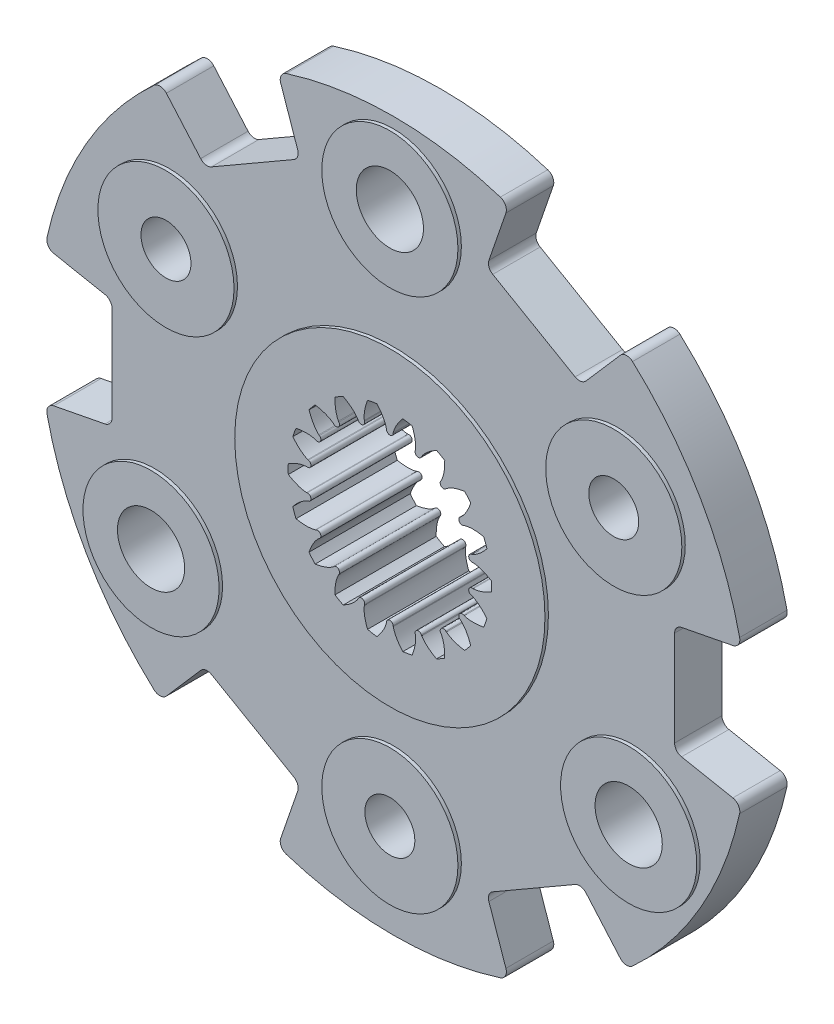
from build123d import *

# Parameters (mm, degrees)
SKETCH1_R                            = 10.4521
BASE_DEPTH                           = 1.397
SKETCH2_R                            = 2.0066
PLATFORMS_DEPTH                      = 0.1016
SKETCH3_R                            = 0.9906
SKETCH3_R_2                          = 0.7366
HOLES_DEPTH                          = 15.857274002
PATTERN_OF_PLATFORMS_AND_HOLES_COUNT = 3
NOTCH_DEPTH                          = 15.847370064
PATTERN_OF_NOTCH_COUNT               = 6
EDGE_FILLET_R                        = 0.254
HUB_DEPTH                            = 1.4859
HUB_DEPTH_BACK                       = 1.4986
SKETCH5_R                            = 4.572
HUB_CHAMFER_SIZE                     = 0.381
INTERNAL_START                       = -1.4859
INTERNAL_CAVITY_DEPTH                = 2.9845
OFFSET_CAVITY_CUT_DEPTH              = 15.915170021


# Read off the part's stored shape, not the designer's step: Internal cavity
with BuildPart() as part:
    # Sketch1 → Base (new body)
    with BuildSketch(Plane.XY):
        Circle(SKETCH1_R)
    extrude(amount=BASE_DEPTH)

    # Sketch2 → Platforms (add)
    with BuildSketch(Plane.XY.offset(1.397)):
        with Locations((0, 8.128)):
            Circle(SKETCH2_R)
        with Locations((0, -7.62)):
            Circle(SKETCH2_R)
    platforms = extrude(amount=PLATFORMS_DEPTH)

    # Sketch3 → Holes (cut, through all)
    with BuildSketch(Plane.XY.offset(1.4986)):
        with Locations((0, 8.128)):
            Circle(SKETCH3_R)
        with Locations((0, -7.62)):
            Circle(SKETCH3_R_2)
    holes = extrude(amount=-HOLES_DEPTH, mode=Mode.SUBTRACT)

    # Pattern of platforms and holes: Platforms, Holes ×3 about axis
    pattern_of_platforms_and_holes_axis = Axis((0, 0, 0), (0, 0, 1))
    add([platforms.rotate(pattern_of_platforms_and_holes_axis, i * 360 / PATTERN_OF_PLATFORMS_AND_HOLES_COUNT) for i in range(1, PATTERN_OF_PLATFORMS_AND_HOLES_COUNT)])
    add([holes.rotate(pattern_of_platforms_and_holes_axis, i * 360 / PATTERN_OF_PLATFORMS_AND_HOLES_COUNT) for i in range(1, PATTERN_OF_PLATFORMS_AND_HOLES_COUNT)], mode=Mode.SUBTRACT)

    # Sketch4 → Notch (cut, through all)
    with BuildSketch(Plane.XY.offset(1.397)):
        with BuildLine():
            Line((-5.540746529, 6.37389976), (-6.857194577, 7.888300003))
            ThreePointArc((-6.857194577, 7.888300003), (-5.22605, 9.051784123), (-3.402870907, 9.882654704))
            Line((-3.402870907, 9.882654704), (-2.749585848, 7.98537713))
            Line((-2.749585848, 7.98537713), (-5.540746529, 6.37389976))
        make_face()
    notch = extrude(amount=-NOTCH_DEPTH, mode=Mode.SUBTRACT)

    # Pattern of notch: Notch ×6 about axis
    pattern_of_notch_axis = Axis((0, 0, 0), (0, 0, 1))
    for i in range(1, PATTERN_OF_NOTCH_COUNT):
        add(notch.rotate(pattern_of_notch_axis, i * 360 / PATTERN_OF_NOTCH_COUNT), mode=Mode.SUBTRACT)

    # Edge fillet
    edge_fillet_edges = [part.edges().sort_by_distance(p)[0] for p in [
        (6.857194577, -7.888300003, 0.6985),
        (3.402870907, -9.882654704, 0.6985),
        (2.749585848, -7.98537713, 0.6985),
        (5.540746529, -6.37389976, 0.6985),
        (10.260065484, 1.994354701, 0.6985),
        (10.260065484, -1.994354701, 0.6985),
        (8.290332378, -1.61147737, 0.6985),
        (8.290332378, 1.61147737, 0.6985),
        (3.402870907, 9.882654704, 0.6985),
        (6.857194577, 7.888300003, 0.6985),
        (5.540746529, 6.37389976, 0.6985),
        (2.749585848, 7.98537713, 0.6985),
        (-6.857194577, 7.888300003, 0.6985),
        (-3.402870907, 9.882654704, 0.6985),
        (-2.749585848, 7.98537713, 0.6985),
        (-5.540746529, 6.37389976, 0.6985),
        (-10.260065484, -1.994354701, 0.6985),
        (-10.260065484, 1.994354701, 0.6985),
        (-8.290332378, 1.61147737, 0.6985),
        (-8.290332378, -1.61147737, 0.6985),
        (-3.402870907, -9.882654704, 0.6985),
        (-6.857194577, -7.888300003, 0.6985),
        (-5.540746529, -6.37389976, 0.6985),
        (-2.749585848, -7.98537713, 0.6985),
    ]]
    fillet(edge_fillet_edges, radius=EDGE_FILLET_R)

    # Sketch5 → Hub (add, two sides: drawn at the far end of the back side and taken through both)
    with BuildSketch(Plane(origin=(0, 0, 0), x_dir=(-1, 0, 0), z_dir=(0, 0, -1)).offset(-HUB_DEPTH_BACK)):
        Circle(SKETCH5_R)
    extrude(amount=HUB_DEPTH + HUB_DEPTH_BACK)

    # Hub chamfer
    hub_chamfer_edges = [part.edges().sort_by_distance(p)[0] for p in [
        (4.572, 0, -1.4859),
    ]]
    chamfer(hub_chamfer_edges, length=HUB_CHAMFER_SIZE)

    # Internal cavity outline → Internal cavity (cut)
    with BuildSketch(Plane.XY.offset(INTERNAL_START)):
        with BuildLine():
            Line((-2.441544292, 0.253382626), (-2.457161288, 0.255003353))
            add(Edge.make_bspline(
                [(-2.457161288, 0.255003353), (-2.511970923, 0.25245669), (-2.674677864, 0.22493294), (-2.825486334, 0.152013752), (-2.91943351, 0.095650308)],
                knots=[0, 0, 0, 0, 0.332628043, 1, 1, 1, 1], degree=3))
            ThreePointArc((-2.91943351, 0.095650308), (-2.921, 0), (-2.91943351, -0.095650308))
            add(Edge.make_bspline(
                [(-2.457161288, -0.255003353), (-2.511970923, -0.25245669), (-2.674677864, -0.22493294), (-2.825486334, -0.152013752), (-2.91943351, -0.095650308)],
                knots=[0, 0, 0, 0, 0.332628043, 1, 1, 1, 1], degree=3))
            Line((-2.457161288, -0.255003353), (-2.441544292, -0.253382626))
            ThreePointArc((-2.441544292, -0.253382626), (-2.251270523, -0.396959734), (-2.380963117, -0.596955545))
            Line((-2.380963117, -0.596955545), (-2.396192614, -0.600773887))
            add(Edge.make_bspline(
                [(-2.396192614, -0.600773887), (-2.446825813, -0.621912967), (-2.590306648, -0.703425883), (-2.707080423, -0.82352704), (-2.776084458, -0.908623179)],
                knots=[0, 0, 0, 0, 0.332628043, 1, 1, 1, 1], degree=3))
            ThreePointArc((-2.776084458, -0.908623179), (-2.744842145, -0.999040839), (-2.710655794, -1.088386956))
            add(Edge.make_bspline(
                [(-2.221760047, -1.080023425), (-2.274135267, -1.096376344), (-2.436443455, -1.12616153), (-2.603096893, -1.109219442), (-2.710655794, -1.088386956)],
                knots=[0, 0, 0, 0, 0.332628043, 1, 1, 1, 1], degree=3))
            Line((-2.221760047, -1.080023425), (-2.207639193, -1.073159113))
            ThreePointArc((-2.207639193, -1.073159113), (-1.979734073, -1.143), (-2.03320265, -1.375292067))
            Line((-2.03320265, -1.375292067), (-2.046207746, -1.38408893))
            add(Edge.make_bspline(
                [(-2.046207746, -1.38408893), (-2.086557399, -1.421270741), (-2.193506221, -1.546941162), (-2.262160662, -1.699738317), (-2.29789865, -1.803303301)],
                knots=[0, 0, 0, 0, 0.332628043, 1, 1, 1, 1], degree=3))
            ThreePointArc((-2.29789865, -1.803303301), (-2.237615818, -1.877582608), (-2.174932985, -1.949848074))
            add(Edge.make_bspline(
                [(-1.718381755, -1.774776732), (-1.762005335, -1.80805683), (-1.904338008, -1.891558419), (-2.066735549, -1.932636897), (-2.174932985, -1.949848074)],
                knots=[0, 0, 0, 0, 0.332628043, 1, 1, 1, 1], degree=3))
            Line((-1.718381755, -1.774776732), (-1.707460225, -1.763496773))
            ThreePointArc((-1.707460225, -1.763496773), (-1.469412476, -1.751177597), (-1.440207937, -1.987748068))
            Line((-1.440207937, -1.987748068), (-1.449420026, -2.00046242))
            add(Edge.make_bspline(
                [(-1.449420026, -2.00046242), (-1.474619368, -2.049202288), (-1.532136572, -2.203872507), (-1.544390938, -2.370936067), (-1.542552351, -2.48047843)],
                knots=[0, 0, 0, 0, 0.332628043, 1, 1, 1, 1], degree=3))
            ThreePointArc((-1.542552351, -2.48047843), (-1.4605, -2.529660204), (-1.376881159, -2.576128738))
            add(Edge.make_bspline(
                [(-1.007741262, -2.255465773), (-1.037351555, -2.301658978), (-1.142541292, -2.428805447), (-1.281095396, -2.522949819), (-1.376881159, -2.576128738)],
                knots=[0, 0, 0, 0, 0.332628043, 1, 1, 1, 1], degree=3))
            Line((-1.007741262, -2.255465773), (-1.001336355, -2.241130695))
            ThreePointArc((-1.001336355, -2.241130695), (-0.781858048, -2.148137331), (-0.673502892, -2.360452317))
            Line((-0.673502892, -2.360452317), (-0.677810859, -2.375550619))
            add(Edge.make_bspline(
                [(-0.677810859, -2.375550619), (-0.684820479, -2.429969796), (-0.68596864, -2.594984302), (-0.640344874, -2.756163937), (-0.601151473, -2.858471253)],
                knots=[0, 0, 0, 0, 0.332628043, 1, 1, 1, 1], degree=3))
            ThreePointArc((-0.601151473, -2.858471253), (-0.507226327, -2.876623447), (-0.412757144, -2.891690257))
            add(Edge.make_bspline(
                [(-0.175552301, -2.464112355), (-0.187577868, -2.517647084), (-0.242937234, -2.673102692), (-0.340936231, -2.808957759), (-0.412757144, -2.891690257)],
                knots=[0, 0, 0, 0, 0.332628043, 1, 1, 1, 1], degree=3))
            Line((-0.175552301, -2.464112355), (-0.174436542, -2.44845118))
            ThreePointArc((-0.174436542, -2.44845118), (0, -2.286), (0.174436542, -2.44845118))
            Line((0.174436542, -2.44845118), (0.175552301, -2.464112355))
            add(Edge.make_bspline(
                [(0.175552301, -2.464112355), (0.187577868, -2.517647084), (0.242937234, -2.673102692), (0.340936231, -2.808957759), (0.412757144, -2.891690257)],
                knots=[0, 0, 0, 0, 0.332628043, 1, 1, 1, 1], degree=3))
            ThreePointArc((0.412757144, -2.891690257), (0.507226327, -2.876623447), (0.601151473, -2.858471253))
            add(Edge.make_bspline(
                [(0.677810859, -2.375550619), (0.684820479, -2.429969796), (0.68596864, -2.594984302), (0.640344874, -2.756163937), (0.601151473, -2.858471253)],
                knots=[0, 0, 0, 0, 0.332628043, 1, 1, 1, 1], degree=3))
            Line((0.677810859, -2.375550619), (0.673502892, -2.360452317))
            ThreePointArc((0.673502892, -2.360452317), (0.781858048, -2.148137331), (1.001336355, -2.241130695))
            Line((1.001336355, -2.241130695), (1.007741262, -2.255465773))
            add(Edge.make_bspline(
                [(1.007741262, -2.255465773), (1.037351555, -2.301658978), (1.142541292, -2.428805447), (1.281095396, -2.522949819), (1.376881159, -2.576128738)],
                knots=[0, 0, 0, 0, 0.332628043, 1, 1, 1, 1], degree=3))
            ThreePointArc((1.376881159, -2.576128738), (1.4605, -2.529660204), (1.542552351, -2.48047843))
            add(Edge.make_bspline(
                [(1.449420026, -2.00046242), (1.474619368, -2.049202288), (1.532136572, -2.203872507), (1.544390938, -2.370936067), (1.542552351, -2.48047843)],
                knots=[0, 0, 0, 0, 0.332628043, 1, 1, 1, 1], degree=3))
            Line((1.449420026, -2.00046242), (1.440207937, -1.987748068))
            ThreePointArc((1.440207937, -1.987748068), (1.469412476, -1.751177597), (1.707460225, -1.763496773))
            Line((1.707460225, -1.763496773), (1.718381755, -1.774776732))
            add(Edge.make_bspline(
                [(1.718381755, -1.774776732), (1.762005335, -1.80805683), (1.904338008, -1.891558419), (2.066735549, -1.932636897), (2.174932985, -1.949848074)],
                knots=[0, 0, 0, 0, 0.332628043, 1, 1, 1, 1], degree=3))
            ThreePointArc((2.174932985, -1.949848074), (2.237615818, -1.877582608), (2.29789865, -1.803303301))
            add(Edge.make_bspline(
                [(2.046207746, -1.38408893), (2.086557399, -1.421270741), (2.193506221, -1.546941162), (2.262160662, -1.699738317), (2.29789865, -1.803303301)],
                knots=[0, 0, 0, 0, 0.332628043, 1, 1, 1, 1], degree=3))
            Line((2.046207746, -1.38408893), (2.03320265, -1.375292067))
            ThreePointArc((2.03320265, -1.375292067), (1.979734073, -1.143), (2.207639193, -1.073159113))
            Line((2.207639193, -1.073159113), (2.221760047, -1.080023425))
            add(Edge.make_bspline(
                [(2.221760047, -1.080023425), (2.274135267, -1.096376344), (2.436443455, -1.12616153), (2.603096893, -1.109219442), (2.710655794, -1.088386956)],
                knots=[0, 0, 0, 0, 0.332628043, 1, 1, 1, 1], degree=3))
            ThreePointArc((2.710655794, -1.088386956), (2.744842145, -0.999040839), (2.776084458, -0.908623179))
            add(Edge.make_bspline(
                [(2.396192614, -0.600773887), (2.446825813, -0.621912967), (2.590306648, -0.703425883), (2.707080423, -0.82352704), (2.776084458, -0.908623179)],
                knots=[0, 0, 0, 0, 0.332628043, 1, 1, 1, 1], degree=3))
            Line((2.396192614, -0.600773887), (2.380963117, -0.596955545))
            ThreePointArc((2.380963117, -0.596955545), (2.251270523, -0.396959734), (2.441544292, -0.253382626))
            Line((2.441544292, -0.253382626), (2.457161288, -0.255003353))
            add(Edge.make_bspline(
                [(2.457161288, -0.255003353), (2.511970923, -0.25245669), (2.674677864, -0.22493294), (2.825486334, -0.152013752), (2.91943351, -0.095650308)],
                knots=[0, 0, 0, 0, 0.332628043, 1, 1, 1, 1], degree=3))
            ThreePointArc((2.91943351, -0.095650308), (2.921, 0), (2.91943351, 0.095650308))
            add(Edge.make_bspline(
                [(2.457161288, 0.255003353), (2.511970923, 0.25245669), (2.674677864, 0.22493294), (2.825486334, 0.152013752), (2.91943351, 0.095650308)],
                knots=[0, 0, 0, 0, 0.332628043, 1, 1, 1, 1], degree=3))
            Line((2.457161288, 0.255003353), (2.441544292, 0.253382626))
            ThreePointArc((2.441544292, 0.253382626), (2.251270523, 0.396959734), (2.380963117, 0.596955545))
            Line((2.380963117, 0.596955545), (2.396192614, 0.600773887))
            add(Edge.make_bspline(
                [(2.396192614, 0.600773887), (2.446825813, 0.621912967), (2.590306648, 0.703425883), (2.707080423, 0.82352704), (2.776084458, 0.908623179)],
                knots=[0, 0, 0, 0, 0.332628043, 1, 1, 1, 1], degree=3))
            ThreePointArc((2.776084458, 0.908623179), (2.744842145, 0.999040839), (2.710655794, 1.088386956))
            add(Edge.make_bspline(
                [(2.221760047, 1.080023425), (2.274135267, 1.096376344), (2.436443455, 1.12616153), (2.603096893, 1.109219442), (2.710655794, 1.088386956)],
                knots=[0, 0, 0, 0, 0.332628043, 1, 1, 1, 1], degree=3))
            Line((2.221760047, 1.080023425), (2.207639193, 1.073159113))
            ThreePointArc((2.207639193, 1.073159113), (1.979734073, 1.143), (2.03320265, 1.375292067))
            Line((2.03320265, 1.375292067), (2.046207746, 1.38408893))
            add(Edge.make_bspline(
                [(2.046207746, 1.38408893), (2.086557399, 1.421270741), (2.193506221, 1.546941162), (2.262160662, 1.699738317), (2.29789865, 1.803303301)],
                knots=[0, 0, 0, 0, 0.332628043, 1, 1, 1, 1], degree=3))
            ThreePointArc((2.29789865, 1.803303301), (2.237615818, 1.877582608), (2.174932985, 1.949848074))
            add(Edge.make_bspline(
                [(1.718381755, 1.774776732), (1.762005335, 1.80805683), (1.904338008, 1.891558419), (2.066735549, 1.932636897), (2.174932985, 1.949848074)],
                knots=[0, 0, 0, 0, 0.332628043, 1, 1, 1, 1], degree=3))
            Line((1.718381755, 1.774776732), (1.707460225, 1.763496773))
            ThreePointArc((1.707460225, 1.763496773), (1.469412476, 1.751177597), (1.440207937, 1.987748068))
            Line((1.440207937, 1.987748068), (1.449420026, 2.00046242))
            add(Edge.make_bspline(
                [(1.449420026, 2.00046242), (1.474619368, 2.049202288), (1.532136572, 2.203872507), (1.544390938, 2.370936067), (1.542552351, 2.48047843)],
                knots=[0, 0, 0, 0, 0.332628043, 1, 1, 1, 1], degree=3))
            ThreePointArc((1.542552351, 2.48047843), (1.4605, 2.529660204), (1.376881159, 2.576128738))
            add(Edge.make_bspline(
                [(1.007741262, 2.255465773), (1.037351555, 2.301658978), (1.142541292, 2.428805447), (1.281095396, 2.522949819), (1.376881159, 2.576128738)],
                knots=[0, 0, 0, 0, 0.332628043, 1, 1, 1, 1], degree=3))
            Line((1.007741262, 2.255465773), (1.001336355, 2.241130695))
            ThreePointArc((1.001336355, 2.241130695), (0.781858048, 2.148137331), (0.673502892, 2.360452317))
            Line((0.673502892, 2.360452317), (0.677810859, 2.375550619))
            add(Edge.make_bspline(
                [(0.677810859, 2.375550619), (0.684820479, 2.429969796), (0.68596864, 2.594984302), (0.640344874, 2.756163937), (0.601151473, 2.858471253)],
                knots=[0, 0, 0, 0, 0.332628043, 1, 1, 1, 1], degree=3))
            ThreePointArc((0.601151473, 2.858471253), (0.507226327, 2.876623447), (0.412757144, 2.891690257))
            add(Edge.make_bspline(
                [(0.175552301, 2.464112355), (0.187577868, 2.517647084), (0.242937234, 2.673102692), (0.340936231, 2.808957759), (0.412757144, 2.891690257)],
                knots=[0, 0, 0, 0, 0.332628043, 1, 1, 1, 1], degree=3))
            Line((0.175552301, 2.464112355), (0.174436542, 2.44845118))
            ThreePointArc((0.174436542, 2.44845118), (0, 2.286), (-0.174436542, 2.44845118))
            Line((-0.174436542, 2.44845118), (-0.175552301, 2.464112355))
            add(Edge.make_bspline(
                [(-0.175552301, 2.464112355), (-0.187577868, 2.517647084), (-0.242937234, 2.673102692), (-0.340936231, 2.808957759), (-0.412757144, 2.891690257)],
                knots=[0, 0, 0, 0, 0.332628043, 1, 1, 1, 1], degree=3))
            ThreePointArc((-0.412757144, 2.891690257), (-0.507226327, 2.876623447), (-0.601151473, 2.858471253))
            add(Edge.make_bspline(
                [(-0.677810859, 2.375550619), (-0.684820479, 2.429969796), (-0.68596864, 2.594984302), (-0.640344874, 2.756163937), (-0.601151473, 2.858471253)],
                knots=[0, 0, 0, 0, 0.332628043, 1, 1, 1, 1], degree=3))
            Line((-0.677810859, 2.375550619), (-0.673502892, 2.360452317))
            ThreePointArc((-0.673502892, 2.360452317), (-0.781858048, 2.148137331), (-1.001336355, 2.241130695))
            Line((-1.001336355, 2.241130695), (-1.007741262, 2.255465773))
            add(Edge.make_bspline(
                [(-1.007741262, 2.255465773), (-1.037351555, 2.301658978), (-1.142541292, 2.428805447), (-1.281095396, 2.522949819), (-1.376881159, 2.576128738)],
                knots=[0, 0, 0, 0, 0.332628043, 1, 1, 1, 1], degree=3))
            ThreePointArc((-1.376881159, 2.576128738), (-1.4605, 2.529660204), (-1.542552351, 2.48047843))
            add(Edge.make_bspline(
                [(-1.449420026, 2.00046242), (-1.474619368, 2.049202288), (-1.532136572, 2.203872507), (-1.544390938, 2.370936067), (-1.542552351, 2.48047843)],
                knots=[0, 0, 0, 0, 0.332628043, 1, 1, 1, 1], degree=3))
            Line((-1.449420026, 2.00046242), (-1.440207937, 1.987748068))
            ThreePointArc((-1.440207937, 1.987748068), (-1.469412476, 1.751177597), (-1.707460225, 1.763496773))
            Line((-1.707460225, 1.763496773), (-1.718381755, 1.774776732))
            add(Edge.make_bspline(
                [(-1.718381755, 1.774776732), (-1.762005335, 1.80805683), (-1.904338008, 1.891558419), (-2.066735549, 1.932636897), (-2.174932985, 1.949848074)],
                knots=[0, 0, 0, 0, 0.332628043, 1, 1, 1, 1], degree=3))
            ThreePointArc((-2.174932985, 1.949848074), (-2.237615818, 1.877582608), (-2.29789865, 1.803303301))
            add(Edge.make_bspline(
                [(-2.046207746, 1.38408893), (-2.086557399, 1.421270741), (-2.193506221, 1.546941162), (-2.262160662, 1.699738317), (-2.29789865, 1.803303301)],
                knots=[0, 0, 0, 0, 0.332628043, 1, 1, 1, 1], degree=3))
            Line((-2.046207746, 1.38408893), (-2.03320265, 1.375292067))
            ThreePointArc((-2.03320265, 1.375292067), (-1.979734073, 1.143), (-2.207639193, 1.073159113))
            Line((-2.207639193, 1.073159113), (-2.221760047, 1.080023425))
            add(Edge.make_bspline(
                [(-2.221760047, 1.080023425), (-2.274135267, 1.096376344), (-2.436443455, 1.12616153), (-2.603096893, 1.109219442), (-2.710655794, 1.088386956)],
                knots=[0, 0, 0, 0, 0.332628043, 1, 1, 1, 1], degree=3))
            ThreePointArc((-2.710655794, 1.088386956), (-2.744842145, 0.999040839), (-2.776084458, 0.908623179))
            add(Edge.make_bspline(
                [(-2.396192614, 0.600773887), (-2.446825813, 0.621912967), (-2.590306648, 0.703425883), (-2.707080423, 0.82352704), (-2.776084458, 0.908623179)],
                knots=[0, 0, 0, 0, 0.332628043, 1, 1, 1, 1], degree=3))
            Line((-2.396192614, 0.600773887), (-2.380963117, 0.596955545))
            ThreePointArc((-2.380963117, 0.596955545), (-2.251270523, 0.396959734), (-2.441544292, 0.253382626))
        make_face()
    extrude(amount=INTERNAL_CAVITY_DEPTH, mode=Mode.SUBTRACT)

    # Sketch6 → Offset cavity cut (cut, through all)
    with BuildSketch(Plane.XY.offset(1.4986)):
        with BuildLine():
            Line((2.420271814, -0.528252538), (2.399494428, -0.523043228))
            ThreePointArc((2.399494428, -0.523043228), (2.326312874, -0.410191725), (2.433678527, -0.329175566))
            Line((2.433678527, -0.329175566), (2.454984573, -0.3313867))
            add(Edge.make_bspline(
                [(2.454984573, -0.3313867), (2.645441737, -0.32253734), (2.830441607, -0.237902523), (2.993937206, -0.139813624)],
                knots=[-0.011557885, -0.011557885, -0.011557885, -0.011557885, 1.083590596, 1.083590596, 1.083590596, 1.083590596], degree=3))
            ThreePointArc((2.993937206, -0.139813624), (2.9972, 0), (2.993937206, 0.139813624))
            add(Edge.make_bspline(
                [(2.993937206, 0.139813624), (2.830441607, 0.237902523), (2.645441737, 0.32253734), (2.454984573, 0.3313867)],
                knots=[-0.083590596, -0.083590596, -0.083590596, -0.083590596, 1.011557885, 1.011557885, 1.011557885, 1.011557885], degree=3))
            Line((2.454984573, 0.3313867), (2.433678527, 0.329175566))
            ThreePointArc((2.433678527, 0.329175566), (2.326312874, 0.410191725), (2.399494428, 0.523043228))
            Line((2.399494428, 0.523043228), (2.420271814, 0.528252538))
            add(Edge.make_bspline(
                [(2.420271814, 0.528252538), (2.596216347, 0.601708404), (2.741112547, 0.744512799), (2.861199775, 0.892605002)],
                knots=[-0.011557885, -0.011557885, -0.011557885, -0.011557885, 1.083590596, 1.083590596, 1.083590596, 1.083590596], degree=3))
            ThreePointArc((2.861199775, 0.892605002), (2.816446723, 1.025102774), (2.765561623, 1.155368663))
            add(Edge.make_bspline(
                [(2.765561623, 1.155368663), (2.578377637, 1.191623289), (2.375587812, 1.207880321), (2.19358996, 1.151055812)],
                knots=[-0.083590596, -0.083590596, -0.083590596, -0.083590596, 1.011557885, 1.011557885, 1.011557885, 1.011557885], degree=3))
            Line((2.19358996, 1.151055812), (2.174325079, 1.141690929))
            ThreePointArc((2.174325079, 1.141690929), (2.045725209, 1.1811), (2.075895887, 1.31217529))
            Line((2.075895887, 1.31217529), (2.093638555, 1.324176725))
            add(Edge.make_bspline(
                [(2.093638555, 1.324176725), (2.233848948, 1.453379234), (2.321164859, 1.63712889), (2.383359424, 1.81736229)],
                knots=[-0.011557885, -0.011557885, -0.011557885, -0.011557885, 1.083590596, 1.083590596, 1.083590596, 1.083590596], degree=3))
            ThreePointArc((2.383359424, 1.81736229), (2.295988405, 1.926563024), (2.203618494, 2.03156919))
            add(Edge.make_bspline(
                [(2.203618494, 2.03156919), (2.015323271, 2.001616701), (1.819202936, 1.947535108), (1.667616025, 1.831890606)],
                knots=[-0.083590596, -0.083590596, -0.083590596, -0.083590596, 1.011557885, 1.011557885, 1.011557885, 1.011557885], degree=3))
            Line((1.667616025, 1.831890606), (1.652715937, 1.816501517))
            ThreePointArc((1.652715937, 1.816501517), (1.518392892, 1.809550184), (1.501913666, 1.943039646))
            Line((1.501913666, 1.943039646), (1.514481587, 1.960385656))
            add(Edge.make_bspline(
                [(1.514481587, 1.960385656), (1.602046399, 2.129751079), (1.621250432, 2.332283075), (1.618050753, 2.522918865)],
                knots=[-0.011557885, -0.011557885, -0.011557885, -0.011557885, 1.083590596, 1.083590596, 1.083590596, 1.083590596], degree=3))
            ThreePointArc((1.618050753, 2.522918865), (1.4986, 2.59565134), (1.375886453, 2.662732489))
            add(Edge.make_bspline(
                [(1.375886453, 2.662732489), (1.209191175, 2.570185597), (1.043395338, 2.452288419), (0.940502985, 2.291772356)],
                knots=[-0.083590596, -0.083590596, -0.083590596, -0.083590596, 1.011557885, 1.011557885, 1.011557885, 1.011557885], degree=3))
            Line((0.940502985, 2.291772356), (0.931764861, 2.272215212))
            ThreePointArc((0.931764861, 2.272215212), (0.807919983, 2.219741909), (0.746778491, 2.339544745))
            Line((0.746778491, 2.339544745), (0.752655789, 2.360143144))
            add(Edge.make_bspline(
                [(0.752655789, 2.360143144), (0.77701341, 2.549243512), (0.725789276, 2.7461295), (0.657581281, 2.924174191)],
                knots=[-0.011557885, -0.011557885, -0.011557885, -0.011557885, 1.083590596, 1.083590596, 1.083590596, 1.083590596], degree=3))
            ThreePointArc((0.657581281, 2.924174191), (0.520458318, 2.951665797), (0.382202199, 2.972730953))
            add(Edge.make_bspline(
                [(0.382202199, 2.972730953), (0.257212778, 2.828752179), (0.141738864, 2.661259554), (0.099951405, 2.475232537)],
                knots=[-0.083590596, -0.083590596, -0.083590596, -0.083590596, 1.011557885, 1.011557885, 1.011557885, 1.011557885], degree=3))
            Line((0.099951405, 2.475232537), (0.098429191, 2.453866219))
            ThreePointArc((0.098429191, 2.453866219), (0, 2.3622), (-0.098429191, 2.453866219))
            Line((-0.098429191, 2.453866219), (-0.099951405, 2.475232537))
            add(Edge.make_bspline(
                [(-0.099951405, 2.475232537), (-0.141738864, 2.661259554), (-0.257212778, 2.828752179), (-0.382202199, 2.972730953)],
                knots=[-0.011557885, -0.011557885, -0.011557885, -0.011557885, 1.083590596, 1.083590596, 1.083590596, 1.083590596], degree=3))
            ThreePointArc((-0.382202199, 2.972730953), (-0.520458318, 2.951665797), (-0.657581281, 2.924174191))
            add(Edge.make_bspline(
                [(-0.657581281, 2.924174191), (-0.725789276, 2.7461295), (-0.77701341, 2.549243512), (-0.752655789, 2.360143144)],
                knots=[-0.083590596, -0.083590596, -0.083590596, -0.083590596, 1.011557885, 1.011557885, 1.011557885, 1.011557885], degree=3))
            Line((-0.752655789, 2.360143144), (-0.746778491, 2.339544745))
            ThreePointArc((-0.746778491, 2.339544745), (-0.807919983, 2.219741909), (-0.931764861, 2.272215212))
            Line((-0.931764861, 2.272215212), (-0.940502985, 2.291772356))
            add(Edge.make_bspline(
                [(-0.940502985, 2.291772356), (-1.043395338, 2.452288419), (-1.209191175, 2.570185597), (-1.375886453, 2.662732489)],
                knots=[-0.011557885, -0.011557885, -0.011557885, -0.011557885, 1.083590596, 1.083590596, 1.083590596, 1.083590596], degree=3))
            ThreePointArc((-1.375886453, 2.662732489), (-1.4986, 2.59565134), (-1.618050753, 2.522918865))
            add(Edge.make_bspline(
                [(-1.618050753, 2.522918865), (-1.621250432, 2.332283075), (-1.602046399, 2.129751079), (-1.514481587, 1.960385656)],
                knots=[-0.083590596, -0.083590596, -0.083590596, -0.083590596, 1.011557885, 1.011557885, 1.011557885, 1.011557885], degree=3))
            Line((-1.514481587, 1.960385656), (-1.501913666, 1.943039646))
            ThreePointArc((-1.501913666, 1.943039646), (-1.518392892, 1.809550184), (-1.652715937, 1.816501517))
            Line((-1.652715937, 1.816501517), (-1.667616025, 1.831890606))
            add(Edge.make_bspline(
                [(-1.667616025, 1.831890606), (-1.819202936, 1.947535108), (-2.015323271, 2.001616701), (-2.203618494, 2.03156919)],
                knots=[-0.011557885, -0.011557885, -0.011557885, -0.011557885, 1.083590596, 1.083590596, 1.083590596, 1.083590596], degree=3))
            ThreePointArc((-2.203618494, 2.03156919), (-2.295988405, 1.926563024), (-2.383359424, 1.81736229))
            add(Edge.make_bspline(
                [(-2.383359424, 1.81736229), (-2.321164859, 1.63712889), (-2.233848948, 1.453379234), (-2.093638555, 1.324176725)],
                knots=[-0.083590596, -0.083590596, -0.083590596, -0.083590596, 1.011557885, 1.011557885, 1.011557885, 1.011557885], degree=3))
            Line((-2.093638555, 1.324176725), (-2.075895887, 1.31217529))
            ThreePointArc((-2.075895887, 1.31217529), (-2.045725209, 1.1811), (-2.174325079, 1.141690929))
            Line((-2.174325079, 1.141690929), (-2.19358996, 1.151055812))
            add(Edge.make_bspline(
                [(-2.19358996, 1.151055812), (-2.375587812, 1.207880321), (-2.578377637, 1.191623289), (-2.765561623, 1.155368663)],
                knots=[-0.011557885, -0.011557885, -0.011557885, -0.011557885, 1.083590596, 1.083590596, 1.083590596, 1.083590596], degree=3))
            ThreePointArc((-2.765561623, 1.155368663), (-2.816446723, 1.025102774), (-2.861199775, 0.892605002))
            add(Edge.make_bspline(
                [(-2.861199775, 0.892605002), (-2.741112547, 0.744512799), (-2.596216347, 0.601708404), (-2.420271814, 0.528252538)],
                knots=[-0.083590596, -0.083590596, -0.083590596, -0.083590596, 1.011557885, 1.011557885, 1.011557885, 1.011557885], degree=3))
            Line((-2.420271814, 0.528252538), (-2.399494428, 0.523043228))
            ThreePointArc((-2.399494428, 0.523043228), (-2.326312874, 0.410191725), (-2.433678527, 0.329175566))
            Line((-2.433678527, 0.329175566), (-2.454984573, 0.3313867))
            add(Edge.make_bspline(
                [(-2.454984573, 0.3313867), (-2.645441737, 0.32253734), (-2.830441607, 0.237902523), (-2.993937206, 0.139813624)],
                knots=[-0.011557885, -0.011557885, -0.011557885, -0.011557885, 1.083590596, 1.083590596, 1.083590596, 1.083590596], degree=3))
            ThreePointArc((-2.993937206, 0.139813624), (-2.9972, 0), (-2.993937206, -0.139813624))
            add(Edge.make_bspline(
                [(-2.993937206, -0.139813624), (-2.830441607, -0.237902523), (-2.645441737, -0.32253734), (-2.454984573, -0.3313867)],
                knots=[-0.083590596, -0.083590596, -0.083590596, -0.083590596, 1.011557885, 1.011557885, 1.011557885, 1.011557885], degree=3))
            Line((-2.454984573, -0.3313867), (-2.433678527, -0.329175566))
            ThreePointArc((-2.433678527, -0.329175566), (-2.326312874, -0.410191725), (-2.399494428, -0.523043228))
            Line((-2.399494428, -0.523043228), (-2.420271814, -0.528252538))
            add(Edge.make_bspline(
                [(-2.420271814, -0.528252538), (-2.596216347, -0.601708404), (-2.741112547, -0.744512799), (-2.861199775, -0.892605002)],
                knots=[-0.011557885, -0.011557885, -0.011557885, -0.011557885, 1.083590596, 1.083590596, 1.083590596, 1.083590596], degree=3))
            ThreePointArc((-2.861199775, -0.892605002), (-2.816446723, -1.025102774), (-2.765561623, -1.155368663))
            add(Edge.make_bspline(
                [(-2.765561623, -1.155368663), (-2.578377637, -1.191623289), (-2.375587812, -1.207880321), (-2.19358996, -1.151055812)],
                knots=[-0.083590596, -0.083590596, -0.083590596, -0.083590596, 1.011557885, 1.011557885, 1.011557885, 1.011557885], degree=3))
            Line((-2.19358996, -1.151055812), (-2.174325079, -1.141690929))
            ThreePointArc((-2.174325079, -1.141690929), (-2.045725209, -1.1811), (-2.075895887, -1.31217529))
            Line((-2.075895887, -1.31217529), (-2.093638555, -1.324176725))
            add(Edge.make_bspline(
                [(-2.093638555, -1.324176725), (-2.233848948, -1.453379234), (-2.321164859, -1.63712889), (-2.383359424, -1.81736229)],
                knots=[-0.011557885, -0.011557885, -0.011557885, -0.011557885, 1.083590596, 1.083590596, 1.083590596, 1.083590596], degree=3))
            ThreePointArc((-2.383359424, -1.81736229), (-2.295988405, -1.926563024), (-2.203618494, -2.03156919))
            add(Edge.make_bspline(
                [(-2.203618494, -2.03156919), (-2.015323271, -2.001616701), (-1.819202936, -1.947535108), (-1.667616025, -1.831890606)],
                knots=[-0.083590596, -0.083590596, -0.083590596, -0.083590596, 1.011557885, 1.011557885, 1.011557885, 1.011557885], degree=3))
            Line((-1.667616025, -1.831890606), (-1.652715937, -1.816501517))
            ThreePointArc((-1.652715937, -1.816501517), (-1.518392892, -1.809550184), (-1.501913666, -1.943039646))
            Line((-1.501913666, -1.943039646), (-1.514481587, -1.960385656))
            add(Edge.make_bspline(
                [(-1.514481587, -1.960385656), (-1.602046399, -2.129751079), (-1.621250432, -2.332283075), (-1.618050753, -2.522918865)],
                knots=[-0.011557885, -0.011557885, -0.011557885, -0.011557885, 1.083590596, 1.083590596, 1.083590596, 1.083590596], degree=3))
            ThreePointArc((-1.618050753, -2.522918865), (-1.4986, -2.59565134), (-1.375886453, -2.662732489))
            add(Edge.make_bspline(
                [(-1.375886453, -2.662732489), (-1.209191175, -2.570185597), (-1.043395338, -2.452288419), (-0.940502985, -2.291772356)],
                knots=[-0.083590596, -0.083590596, -0.083590596, -0.083590596, 1.011557885, 1.011557885, 1.011557885, 1.011557885], degree=3))
            Line((-0.940502985, -2.291772356), (-0.931764861, -2.272215212))
            ThreePointArc((-0.931764861, -2.272215212), (-0.807919983, -2.219741909), (-0.746778491, -2.339544745))
            Line((-0.746778491, -2.339544745), (-0.752655789, -2.360143144))
            add(Edge.make_bspline(
                [(-0.752655789, -2.360143144), (-0.77701341, -2.549243512), (-0.725789276, -2.7461295), (-0.657581281, -2.924174191)],
                knots=[-0.011557885, -0.011557885, -0.011557885, -0.011557885, 1.083590596, 1.083590596, 1.083590596, 1.083590596], degree=3))
            ThreePointArc((-0.657581281, -2.924174191), (-0.520458318, -2.951665797), (-0.382202199, -2.972730953))
            add(Edge.make_bspline(
                [(-0.382202199, -2.972730953), (-0.257212778, -2.828752179), (-0.141738864, -2.661259554), (-0.099951405, -2.475232537)],
                knots=[-0.083590596, -0.083590596, -0.083590596, -0.083590596, 1.011557885, 1.011557885, 1.011557885, 1.011557885], degree=3))
            Line((-0.099951405, -2.475232537), (-0.098429191, -2.453866219))
            ThreePointArc((-0.098429191, -2.453866219), (0, -2.3622), (0.098429191, -2.453866219))
            Line((0.098429191, -2.453866219), (0.099951405, -2.475232537))
            add(Edge.make_bspline(
                [(0.099951405, -2.475232537), (0.141738864, -2.661259554), (0.257212778, -2.828752179), (0.382202199, -2.972730953)],
                knots=[-0.011557885, -0.011557885, -0.011557885, -0.011557885, 1.083590596, 1.083590596, 1.083590596, 1.083590596], degree=3))
            ThreePointArc((0.382202199, -2.972730953), (0.520458318, -2.951665797), (0.657581281, -2.924174191))
            add(Edge.make_bspline(
                [(0.657581281, -2.924174191), (0.725789276, -2.7461295), (0.77701341, -2.549243512), (0.752655789, -2.360143144)],
                knots=[-0.083590596, -0.083590596, -0.083590596, -0.083590596, 1.011557885, 1.011557885, 1.011557885, 1.011557885], degree=3))
            Line((0.752655789, -2.360143144), (0.746778491, -2.339544745))
            ThreePointArc((0.746778491, -2.339544745), (0.807919983, -2.219741909), (0.931764861, -2.272215212))
            Line((0.931764861, -2.272215212), (0.940502985, -2.291772356))
            add(Edge.make_bspline(
                [(0.940502985, -2.291772356), (1.043395338, -2.452288419), (1.209191175, -2.570185597), (1.375886453, -2.662732489)],
                knots=[-0.011557885, -0.011557885, -0.011557885, -0.011557885, 1.083590596, 1.083590596, 1.083590596, 1.083590596], degree=3))
            ThreePointArc((1.375886453, -2.662732489), (1.4986, -2.59565134), (1.618050753, -2.522918865))
            add(Edge.make_bspline(
                [(1.618050753, -2.522918865), (1.621250432, -2.332283075), (1.602046399, -2.129751079), (1.514481587, -1.960385656)],
                knots=[-0.083590596, -0.083590596, -0.083590596, -0.083590596, 1.011557885, 1.011557885, 1.011557885, 1.011557885], degree=3))
            Line((1.514481587, -1.960385656), (1.501913666, -1.943039646))
            ThreePointArc((1.501913666, -1.943039646), (1.518392892, -1.809550184), (1.652715937, -1.816501517))
            Line((1.652715937, -1.816501517), (1.667616025, -1.831890606))
            add(Edge.make_bspline(
                [(1.667616025, -1.831890606), (1.819202936, -1.947535108), (2.015323271, -2.001616701), (2.203618494, -2.03156919)],
                knots=[-0.011557885, -0.011557885, -0.011557885, -0.011557885, 1.083590596, 1.083590596, 1.083590596, 1.083590596], degree=3))
            ThreePointArc((2.203618494, -2.03156919), (2.295988405, -1.926563024), (2.383359424, -1.81736229))
            add(Edge.make_bspline(
                [(2.383359424, -1.81736229), (2.321164859, -1.63712889), (2.233848948, -1.453379234), (2.093638555, -1.324176725)],
                knots=[-0.083590596, -0.083590596, -0.083590596, -0.083590596, 1.011557885, 1.011557885, 1.011557885, 1.011557885], degree=3))
            Line((2.093638555, -1.324176725), (2.075895887, -1.31217529))
            ThreePointArc((2.075895887, -1.31217529), (2.045725209, -1.1811), (2.174325079, -1.141690929))
            Line((2.174325079, -1.141690929), (2.19358996, -1.151055812))
            add(Edge.make_bspline(
                [(2.19358996, -1.151055812), (2.375587812, -1.207880321), (2.578377637, -1.191623289), (2.765561623, -1.155368663)],
                knots=[-0.011557885, -0.011557885, -0.011557885, -0.011557885, 1.083590596, 1.083590596, 1.083590596, 1.083590596], degree=3))
            ThreePointArc((2.765561623, -1.155368663), (2.816446723, -1.025102774), (2.861199775, -0.892605002))
            add(Edge.make_bspline(
                [(2.861199775, -0.892605002), (2.741112547, -0.744512799), (2.596216347, -0.601708404), (2.420271814, -0.528252538)],
                knots=[-0.083590596, -0.083590596, -0.083590596, -0.083590596, 1.011557885, 1.011557885, 1.011557885, 1.011557885], degree=3))
        make_face()
        with BuildLine():
            Line((-1.440207937, -1.987748068), (-1.449420026, -2.00046242))
            add(Edge.make_bspline(
                [(-1.449420026, -2.00046242), (-1.474619368, -2.049202288), (-1.532136572, -2.203872507), (-1.544390938, -2.370936067), (-1.542552351, -2.48047843)],
                knots=[0, 0, 0, 0, 0.332628043, 1, 1, 1, 1], degree=3))
            ThreePointArc((-1.542552351, -2.48047843), (-1.4605, -2.529660204), (-1.376881159, -2.576128738))
            add(Edge.make_bspline(
                [(-1.376881159, -2.576128738), (-1.281095396, -2.522949819), (-1.142541292, -2.428805447), (-1.037351555, -2.301658978), (-1.007741262, -2.255465773)],
                knots=[0, 0, 0, 0, 0.667371957, 1, 1, 1, 1], degree=3))
            Line((-1.007741262, -2.255465773), (-1.001336355, -2.241130695))
            ThreePointArc((-1.001336355, -2.241130695), (-0.781858048, -2.148137331), (-0.673502892, -2.360452317))
            Line((-0.673502892, -2.360452317), (-0.677810859, -2.375550619))
            add(Edge.make_bspline(
                [(-0.677810859, -2.375550619), (-0.684820479, -2.429969796), (-0.68596864, -2.594984302), (-0.640344874, -2.756163937), (-0.601151473, -2.858471253)],
                knots=[0, 0, 0, 0, 0.332628043, 1, 1, 1, 1], degree=3))
            ThreePointArc((-0.601151473, -2.858471253), (-0.507226327, -2.876623447), (-0.412757144, -2.891690257))
            add(Edge.make_bspline(
                [(-0.412757144, -2.891690257), (-0.340936231, -2.808957759), (-0.242937234, -2.673102692), (-0.187577868, -2.517647084), (-0.175552301, -2.464112355)],
                knots=[0, 0, 0, 0, 0.667371957, 1, 1, 1, 1], degree=3))
            Line((-0.175552301, -2.464112355), (-0.174436542, -2.44845118))
            ThreePointArc((-0.174436542, -2.44845118), (0, -2.286), (0.174436542, -2.44845118))
            Line((0.174436542, -2.44845118), (0.175552301, -2.464112355))
            add(Edge.make_bspline(
                [(0.175552301, -2.464112355), (0.187577868, -2.517647084), (0.242937234, -2.673102692), (0.340936231, -2.808957759), (0.412757144, -2.891690257)],
                knots=[0, 0, 0, 0, 0.332628043, 1, 1, 1, 1], degree=3))
            ThreePointArc((0.412757144, -2.891690257), (0.507226327, -2.876623447), (0.601151473, -2.858471253))
            add(Edge.make_bspline(
                [(0.601151473, -2.858471253), (0.640344874, -2.756163937), (0.68596864, -2.594984302), (0.684820479, -2.429969796), (0.677810859, -2.375550619)],
                knots=[0, 0, 0, 0, 0.667371957, 1, 1, 1, 1], degree=3))
            Line((0.677810859, -2.375550619), (0.673502892, -2.360452317))
            ThreePointArc((0.673502892, -2.360452317), (0.781858048, -2.148137331), (1.001336355, -2.241130695))
            Line((1.001336355, -2.241130695), (1.007741262, -2.255465773))
            add(Edge.make_bspline(
                [(1.007741262, -2.255465773), (1.037351555, -2.301658978), (1.142541292, -2.428805447), (1.281095396, -2.522949819), (1.376881159, -2.576128738)],
                knots=[0, 0, 0, 0, 0.332628043, 1, 1, 1, 1], degree=3))
            ThreePointArc((1.376881159, -2.576128738), (1.4605, -2.529660204), (1.542552351, -2.48047843))
            add(Edge.make_bspline(
                [(1.542552351, -2.48047843), (1.544390938, -2.370936067), (1.532136572, -2.203872507), (1.474619368, -2.049202288), (1.449420026, -2.00046242)],
                knots=[0, 0, 0, 0, 0.667371957, 1, 1, 1, 1], degree=3))
            Line((1.449420026, -2.00046242), (1.440207937, -1.987748068))
            ThreePointArc((1.440207937, -1.987748068), (1.469412476, -1.751177597), (1.707460225, -1.763496773))
            Line((1.707460225, -1.763496773), (1.718381755, -1.774776732))
            add(Edge.make_bspline(
                [(1.718381755, -1.774776732), (1.762005335, -1.80805683), (1.904338008, -1.891558419), (2.066735549, -1.932636897), (2.174932985, -1.949848074)],
                knots=[0, 0, 0, 0, 0.332628043, 1, 1, 1, 1], degree=3))
            ThreePointArc((2.174932985, -1.949848074), (2.237615818, -1.877582608), (2.29789865, -1.803303301))
            add(Edge.make_bspline(
                [(2.29789865, -1.803303301), (2.262160662, -1.699738317), (2.193506221, -1.546941162), (2.086557399, -1.421270741), (2.046207746, -1.38408893)],
                knots=[0, 0, 0, 0, 0.667371957, 1, 1, 1, 1], degree=3))
            Line((2.046207746, -1.38408893), (2.03320265, -1.375292067))
            ThreePointArc((2.03320265, -1.375292067), (1.979734073, -1.143), (2.207639193, -1.073159113))
            Line((2.207639193, -1.073159113), (2.221760047, -1.080023425))
            add(Edge.make_bspline(
                [(2.221760047, -1.080023425), (2.274135267, -1.096376344), (2.436443455, -1.12616153), (2.603096893, -1.109219442), (2.710655794, -1.088386956)],
                knots=[0, 0, 0, 0, 0.332628043, 1, 1, 1, 1], degree=3))
            ThreePointArc((2.710655794, -1.088386956), (2.744842145, -0.999040839), (2.776084458, -0.908623179))
            add(Edge.make_bspline(
                [(2.776084458, -0.908623179), (2.707080423, -0.82352704), (2.590306648, -0.703425883), (2.446825813, -0.621912967), (2.396192614, -0.600773887)],
                knots=[0, 0, 0, 0, 0.667371957, 1, 1, 1, 1], degree=3))
            Line((2.396192614, -0.600773887), (2.380963117, -0.596955545))
            ThreePointArc((2.380963117, -0.596955545), (2.251270523, -0.396959734), (2.441544292, -0.253382626))
            Line((2.441544292, -0.253382626), (2.457161288, -0.255003353))
            add(Edge.make_bspline(
                [(2.457161288, -0.255003353), (2.511970923, -0.25245669), (2.674677864, -0.22493294), (2.825486334, -0.152013752), (2.91943351, -0.095650308)],
                knots=[0, 0, 0, 0, 0.332628043, 1, 1, 1, 1], degree=3))
            ThreePointArc((2.91943351, -0.095650308), (2.921, 0), (2.91943351, 0.095650308))
            add(Edge.make_bspline(
                [(2.91943351, 0.095650308), (2.825486334, 0.152013752), (2.674677864, 0.22493294), (2.511970923, 0.25245669), (2.457161288, 0.255003353)],
                knots=[0, 0, 0, 0, 0.667371957, 1, 1, 1, 1], degree=3))
            Line((2.457161288, 0.255003353), (2.441544292, 0.253382626))
            ThreePointArc((2.441544292, 0.253382626), (2.251270523, 0.396959734), (2.380963117, 0.596955545))
            Line((2.380963117, 0.596955545), (2.396192614, 0.600773887))
            add(Edge.make_bspline(
                [(2.396192614, 0.600773887), (2.446825813, 0.621912967), (2.590306648, 0.703425883), (2.707080423, 0.82352704), (2.776084458, 0.908623179)],
                knots=[0, 0, 0, 0, 0.332628043, 1, 1, 1, 1], degree=3))
            ThreePointArc((2.776084458, 0.908623179), (2.744842145, 0.999040839), (2.710655794, 1.088386956))
            add(Edge.make_bspline(
                [(2.710655794, 1.088386956), (2.603096893, 1.109219442), (2.436443455, 1.12616153), (2.274135267, 1.096376344), (2.221760047, 1.080023425)],
                knots=[0, 0, 0, 0, 0.667371957, 1, 1, 1, 1], degree=3))
            Line((2.221760047, 1.080023425), (2.207639193, 1.073159113))
            ThreePointArc((2.207639193, 1.073159113), (1.979734073, 1.143), (2.03320265, 1.375292067))
            Line((2.03320265, 1.375292067), (2.046207746, 1.38408893))
            add(Edge.make_bspline(
                [(2.046207746, 1.38408893), (2.086557399, 1.421270741), (2.193506221, 1.546941162), (2.262160662, 1.699738317), (2.29789865, 1.803303301)],
                knots=[0, 0, 0, 0, 0.332628043, 1, 1, 1, 1], degree=3))
            ThreePointArc((2.29789865, 1.803303301), (2.237615818, 1.877582608), (2.174932985, 1.949848074))
            add(Edge.make_bspline(
                [(2.174932985, 1.949848074), (2.066735549, 1.932636897), (1.904338008, 1.891558419), (1.762005335, 1.80805683), (1.718381755, 1.774776732)],
                knots=[0, 0, 0, 0, 0.667371957, 1, 1, 1, 1], degree=3))
            Line((1.718381755, 1.774776732), (1.707460225, 1.763496773))
            ThreePointArc((1.707460225, 1.763496773), (1.469412476, 1.751177597), (1.440207937, 1.987748068))
            Line((1.440207937, 1.987748068), (1.449420026, 2.00046242))
            add(Edge.make_bspline(
                [(1.449420026, 2.00046242), (1.474619368, 2.049202288), (1.532136572, 2.203872507), (1.544390938, 2.370936067), (1.542552351, 2.48047843)],
                knots=[0, 0, 0, 0, 0.332628043, 1, 1, 1, 1], degree=3))
            ThreePointArc((1.542552351, 2.48047843), (1.4605, 2.529660204), (1.376881159, 2.576128738))
            add(Edge.make_bspline(
                [(1.376881159, 2.576128738), (1.281095396, 2.522949819), (1.142541292, 2.428805447), (1.037351555, 2.301658978), (1.007741262, 2.255465773)],
                knots=[0, 0, 0, 0, 0.667371957, 1, 1, 1, 1], degree=3))
            Line((1.007741262, 2.255465773), (1.001336355, 2.241130695))
            ThreePointArc((1.001336355, 2.241130695), (0.781858048, 2.148137331), (0.673502892, 2.360452317))
            Line((0.673502892, 2.360452317), (0.677810859, 2.375550619))
            add(Edge.make_bspline(
                [(0.677810859, 2.375550619), (0.684820479, 2.429969796), (0.68596864, 2.594984302), (0.640344874, 2.756163937), (0.601151473, 2.858471253)],
                knots=[0, 0, 0, 0, 0.332628043, 1, 1, 1, 1], degree=3))
            ThreePointArc((0.601151473, 2.858471253), (0.507226327, 2.876623447), (0.412757144, 2.891690257))
            add(Edge.make_bspline(
                [(0.412757144, 2.891690257), (0.340936231, 2.808957759), (0.242937234, 2.673102692), (0.187577868, 2.517647084), (0.175552301, 2.464112355)],
                knots=[0, 0, 0, 0, 0.667371957, 1, 1, 1, 1], degree=3))
            Line((0.175552301, 2.464112355), (0.174436542, 2.44845118))
            ThreePointArc((0.174436542, 2.44845118), (0, 2.286), (-0.174436542, 2.44845118))
            Line((-0.174436542, 2.44845118), (-0.175552301, 2.464112355))
            add(Edge.make_bspline(
                [(-0.175552301, 2.464112355), (-0.187577868, 2.517647084), (-0.242937234, 2.673102692), (-0.340936231, 2.808957759), (-0.412757144, 2.891690257)],
                knots=[0, 0, 0, 0, 0.332628043, 1, 1, 1, 1], degree=3))
            ThreePointArc((-0.412757144, 2.891690257), (-0.507226327, 2.876623447), (-0.601151473, 2.858471253))
            add(Edge.make_bspline(
                [(-0.601151473, 2.858471253), (-0.640344874, 2.756163937), (-0.68596864, 2.594984302), (-0.684820479, 2.429969796), (-0.677810859, 2.375550619)],
                knots=[0, 0, 0, 0, 0.667371957, 1, 1, 1, 1], degree=3))
            Line((-0.677810859, 2.375550619), (-0.673502892, 2.360452317))
            ThreePointArc((-0.673502892, 2.360452317), (-0.781858048, 2.148137331), (-1.001336355, 2.241130695))
            Line((-1.001336355, 2.241130695), (-1.007741262, 2.255465773))
            add(Edge.make_bspline(
                [(-1.007741262, 2.255465773), (-1.037351555, 2.301658978), (-1.142541292, 2.428805447), (-1.281095396, 2.522949819), (-1.376881159, 2.576128738)],
                knots=[0, 0, 0, 0, 0.332628043, 1, 1, 1, 1], degree=3))
            ThreePointArc((-1.376881159, 2.576128738), (-1.4605, 2.529660204), (-1.542552351, 2.48047843))
            add(Edge.make_bspline(
                [(-1.542552351, 2.48047843), (-1.544390938, 2.370936067), (-1.532136572, 2.203872507), (-1.474619368, 2.049202288), (-1.449420026, 2.00046242)],
                knots=[0, 0, 0, 0, 0.667371957, 1, 1, 1, 1], degree=3))
            Line((-1.449420026, 2.00046242), (-1.440207937, 1.987748068))
            ThreePointArc((-1.440207937, 1.987748068), (-1.469412476, 1.751177597), (-1.707460225, 1.763496773))
            Line((-1.707460225, 1.763496773), (-1.718381755, 1.774776732))
            add(Edge.make_bspline(
                [(-1.718381755, 1.774776732), (-1.762005335, 1.80805683), (-1.904338008, 1.891558419), (-2.066735549, 1.932636897), (-2.174932985, 1.949848074)],
                knots=[0, 0, 0, 0, 0.332628043, 1, 1, 1, 1], degree=3))
            ThreePointArc((-2.174932985, 1.949848074), (-2.237615818, 1.877582608), (-2.29789865, 1.803303301))
            add(Edge.make_bspline(
                [(-2.29789865, 1.803303301), (-2.262160662, 1.699738317), (-2.193506221, 1.546941162), (-2.086557399, 1.421270741), (-2.046207746, 1.38408893)],
                knots=[0, 0, 0, 0, 0.667371957, 1, 1, 1, 1], degree=3))
            Line((-2.046207746, 1.38408893), (-2.03320265, 1.375292067))
            ThreePointArc((-2.03320265, 1.375292067), (-1.979734073, 1.143), (-2.207639193, 1.073159113))
            Line((-2.207639193, 1.073159113), (-2.221760047, 1.080023425))
            add(Edge.make_bspline(
                [(-2.221760047, 1.080023425), (-2.274135267, 1.096376344), (-2.436443455, 1.12616153), (-2.603096893, 1.109219442), (-2.710655794, 1.088386956)],
                knots=[0, 0, 0, 0, 0.332628043, 1, 1, 1, 1], degree=3))
            ThreePointArc((-2.710655794, 1.088386956), (-2.744842145, 0.999040839), (-2.776084458, 0.908623179))
            add(Edge.make_bspline(
                [(-2.776084458, 0.908623179), (-2.707080423, 0.82352704), (-2.590306648, 0.703425883), (-2.446825813, 0.621912967), (-2.396192614, 0.600773887)],
                knots=[0, 0, 0, 0, 0.667371957, 1, 1, 1, 1], degree=3))
            Line((-2.396192614, 0.600773887), (-2.380963117, 0.596955545))
            ThreePointArc((-2.380963117, 0.596955545), (-2.251270523, 0.396959734), (-2.441544292, 0.253382626))
            Line((-2.441544292, 0.253382626), (-2.457161288, 0.255003353))
            add(Edge.make_bspline(
                [(-2.457161288, 0.255003353), (-2.511970923, 0.25245669), (-2.674677864, 0.22493294), (-2.825486334, 0.152013752), (-2.91943351, 0.095650308)],
                knots=[0, 0, 0, 0, 0.332628043, 1, 1, 1, 1], degree=3))
            ThreePointArc((-2.91943351, 0.095650308), (-2.921, 0), (-2.91943351, -0.095650308))
            add(Edge.make_bspline(
                [(-2.91943351, -0.095650308), (-2.825486334, -0.152013752), (-2.674677864, -0.22493294), (-2.511970923, -0.25245669), (-2.457161288, -0.255003353)],
                knots=[0, 0, 0, 0, 0.667371957, 1, 1, 1, 1], degree=3))
            Line((-2.457161288, -0.255003353), (-2.441544292, -0.253382626))
            ThreePointArc((-2.441544292, -0.253382626), (-2.251270523, -0.396959734), (-2.380963117, -0.596955545))
            Line((-2.380963117, -0.596955545), (-2.396192614, -0.600773887))
            add(Edge.make_bspline(
                [(-2.396192614, -0.600773887), (-2.446825813, -0.621912967), (-2.590306648, -0.703425883), (-2.707080423, -0.82352704), (-2.776084458, -0.908623179)],
                knots=[0, 0, 0, 0, 0.332628043, 1, 1, 1, 1], degree=3))
            ThreePointArc((-2.776084458, -0.908623179), (-2.744842145, -0.999040839), (-2.710655794, -1.088386956))
            add(Edge.make_bspline(
                [(-2.710655794, -1.088386956), (-2.603096893, -1.109219442), (-2.436443455, -1.12616153), (-2.274135267, -1.096376344), (-2.221760047, -1.080023425)],
                knots=[0, 0, 0, 0, 0.667371957, 1, 1, 1, 1], degree=3))
            Line((-2.221760047, -1.080023425), (-2.207639193, -1.073159113))
            ThreePointArc((-2.207639193, -1.073159113), (-1.979734073, -1.143), (-2.03320265, -1.375292067))
            Line((-2.03320265, -1.375292067), (-2.046207746, -1.38408893))
            add(Edge.make_bspline(
                [(-2.046207746, -1.38408893), (-2.086557399, -1.421270741), (-2.193506221, -1.546941162), (-2.262160662, -1.699738317), (-2.29789865, -1.803303301)],
                knots=[0, 0, 0, 0, 0.332628043, 1, 1, 1, 1], degree=3))
            ThreePointArc((-2.29789865, -1.803303301), (-2.237615818, -1.877582608), (-2.174932985, -1.949848074))
            add(Edge.make_bspline(
                [(-2.174932985, -1.949848074), (-2.066735549, -1.932636897), (-1.904338008, -1.891558419), (-1.762005335, -1.80805683), (-1.718381755, -1.774776732)],
                knots=[0, 0, 0, 0, 0.667371957, 1, 1, 1, 1], degree=3))
            Line((-1.718381755, -1.774776732), (-1.707460225, -1.763496773))
            ThreePointArc((-1.707460225, -1.763496773), (-1.469412476, -1.751177597), (-1.440207937, -1.987748068))
        make_face(mode=Mode.SUBTRACT)
    extrude(amount=-OFFSET_CAVITY_CUT_DEPTH, mode=Mode.SUBTRACT)


solid = part.part
